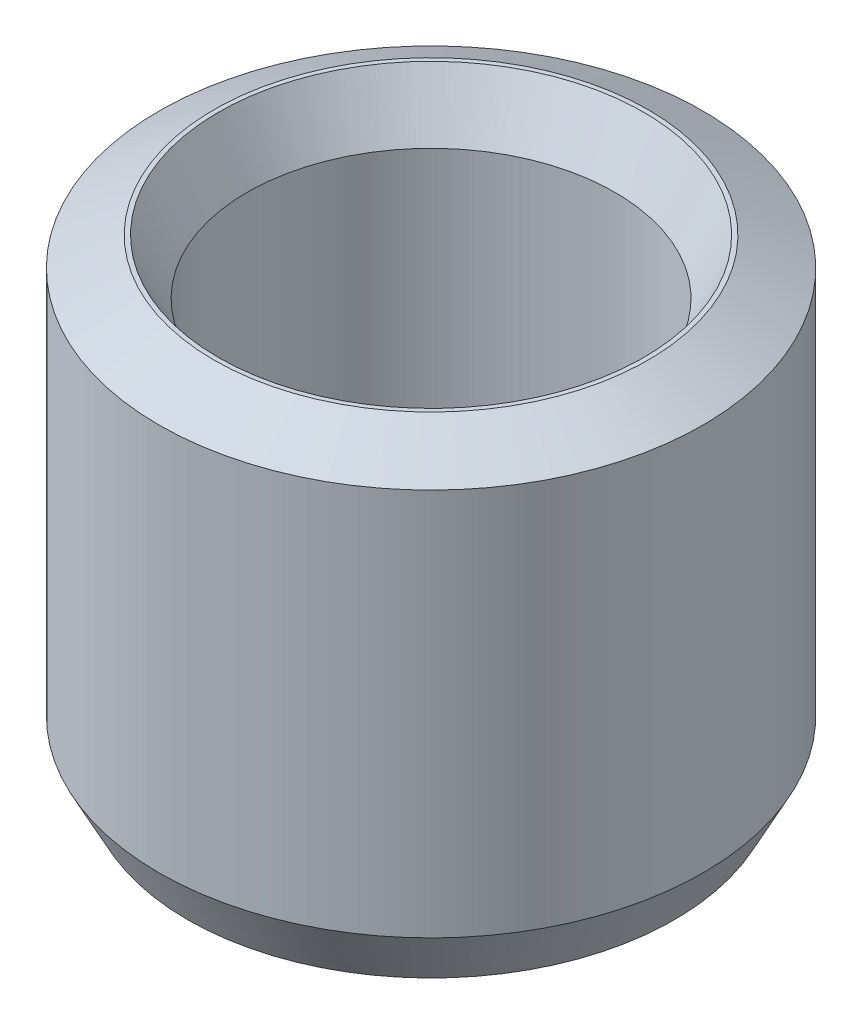
from build123d import *
from OCP.BRepFilletAPI import BRepFilletAPI_MakeChamfer

# Parameters (mm, degrees)
SKETCH1_R           = 20
BOSS_EXTRUDE1_DEPTH = 34.671364881
SKETCH2_R           = 13.51813368
CUT_EXTRUDE1_DEPTH  = 45.744871692
CHAMFER1_SIZE       = 2.11055446
CHAMFER1_SIZE2      = 4.045035817


with BuildPart() as part:
    # Sketch1 → Boss-Extrude1 (new body)
    with BuildSketch(Plane(origin=(0, 0, 0), x_dir=(1, 0, 0), z_dir=(0, 1, 0))):
        Circle(SKETCH1_R)
    extrude(amount=BOSS_EXTRUDE1_DEPTH)

    # Sketch2 → Cut-Extrude1 (cut, through all)
    with BuildSketch(Plane(origin=(0, 0, 0), x_dir=(1, 0, 0), z_dir=(0, 1, 0))):
        Circle(SKETCH2_R)
    extrude(amount=CUT_EXTRUDE1_DEPTH, mode=Mode.SUBTRACT)

    # Chamfer1: one chamfer whose edges measure the first distance from different faces: ONE call of the kernel's chamfer builder (chamfer() names one face for all edges)
    chamfer1_edges_1 = [part.edges().sort_by_distance(p)[0] for p in [
        (-13.51813368, 34.671364881, 0),
    ]]
    chamfer1_side_1 = [part.faces().sort_by_distance(p)[0] for p in [
        (-19.434314575, 34.671364881, 0),
    ]]
    chamfer1_edges_2 = [part.edges().sort_by_distance(p)[0] for p in [
        (-13.51813368, 0, 0),
    ]]
    chamfer1_side_2 = [part.faces().sort_by_distance(p)[0] for p in [
        (-13.51813368, 17.335682441, 0),
    ]]
    chamfer1_edges_3 = [part.edges().sort_by_distance(p)[0] for p in [
        (-20, 0, 0),
    ]]
    chamfer1_side_3 = [part.faces().sort_by_distance(p)[0] for p in [
        (-19.434314575, 0, 0),
    ]]
    chamfer1_edges_4 = [part.edges().sort_by_distance(p)[0] for p in [
        (-20, 34.671364881, 0),
    ]]
    chamfer1_side_4 = [part.faces().sort_by_distance(p)[0] for p in [
        (-20, 17.335682441, 0),
    ]]
    chamfer1 = BRepFilletAPI_MakeChamfer(part.part.solid().wrapped)
    for e in chamfer1_edges_1:
        chamfer1.Add(CHAMFER1_SIZE, CHAMFER1_SIZE2, e.wrapped, chamfer1_side_1[0].wrapped)  # the first distance lies on this face
    for e in chamfer1_edges_2:
        chamfer1.Add(CHAMFER1_SIZE, CHAMFER1_SIZE2, e.wrapped, chamfer1_side_2[0].wrapped)  # the first distance lies on this face
    for e in chamfer1_edges_3:
        chamfer1.Add(CHAMFER1_SIZE, CHAMFER1_SIZE2, e.wrapped, chamfer1_side_3[0].wrapped)  # the first distance lies on this face
    for e in chamfer1_edges_4:
        chamfer1.Add(CHAMFER1_SIZE, CHAMFER1_SIZE2, e.wrapped, chamfer1_side_4[0].wrapped)  # the first distance lies on this face
    add(Compound.cast(chamfer1.Shape()), mode=Mode.REPLACE)


solid = part.part
